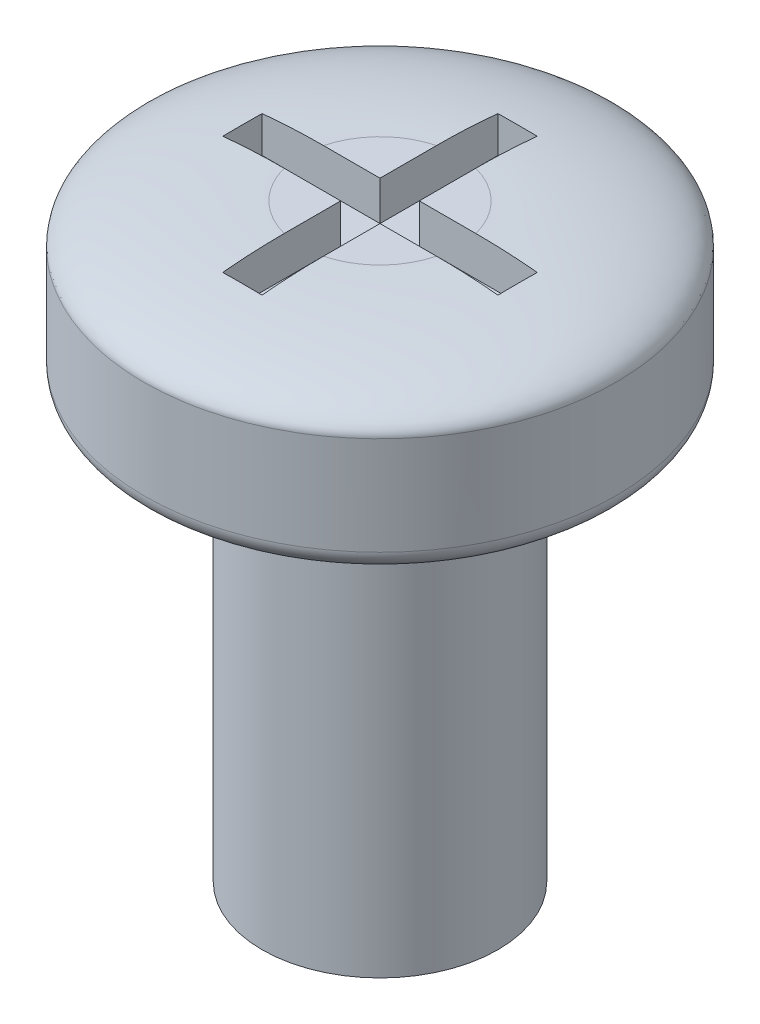
from build123d import *

# Parameters (mm, degrees)
SKETCH1_R           = 3
BOSS_EXTRUDE1_DEPTH = 2
SKETCH2_R           = 1.5
BOSS_EXTRUDE2_DEPTH = 5.5
FILLET2_SIZE        = 0.5
FILLET2_SIZE_2      = 2
SKETCH3_W           = 3.5
SKETCH3_H           = 0.5
SKETCH3_W_2         = 0.5
SKETCH3_H_2         = 3.5
CUT_EXTRUDE1_DEPTH  = 0.5
FILLET3_R           = 0.25


with BuildPart() as part:
    # Sketch1 → Boss-Extrude1 (new body)
    with BuildSketch(Plane(origin=(0, 0, 0), x_dir=(1, 0, 0), z_dir=(0, 1, 0))):
        with Locations(Location((0, 0, 0), (0, 0, 270))):
            Circle(SKETCH1_R)
    extrude(amount=BOSS_EXTRUDE1_DEPTH)

    # Sketch2 → Boss-Extrude2 (add)
    with BuildSketch(Plane.XZ):
        with Locations(Location((0, 0, 0), (0, 0, 270))):
            Circle(SKETCH2_R)
    extrude(amount=BOSS_EXTRUDE2_DEPTH)

    # Fillet2
    # an asymmetric fillet: 2, 0.5 mm, written as the material it takes off along each edge
    with BuildSketch(Plane(origin=(0, 2, 0), x_dir=(0, 0, 1), z_dir=(-1, 0, 0))) as fillet2_piece_1:
        with BuildLine():
            Bezier((3, -FILLET2_SIZE), (3, 0), (3 - FILLET2_SIZE_2, 0), weights=[1, 0.707106781, 1])
            Line((3 - FILLET2_SIZE_2, 0), (3, 0))
            Line((3, 0), (3, -FILLET2_SIZE))
        make_face()
    revolve(axis=Axis((0, 2, 0), (0, 1, 0)), mode=Mode.SUBTRACT)

    # Sketch3 → Cut-Extrude1 (cut)
    with BuildSketch(Plane(origin=(0, 2, 0), x_dir=(1, 0, 0), z_dir=(0, 1, 0))):
        Rectangle(SKETCH3_W, SKETCH3_H)
        Rectangle(SKETCH3_W_2, SKETCH3_H_2)
    extrude(amount=-CUT_EXTRUDE1_DEPTH, mode=Mode.SUBTRACT)

    # Fillet3
    fillet3_edges = [part.edges().sort_by_distance(p)[0] for p in [
        (0, 0, -3),
    ]]
    fillet(fillet3_edges, radius=FILLET3_R)


solid = part.part
